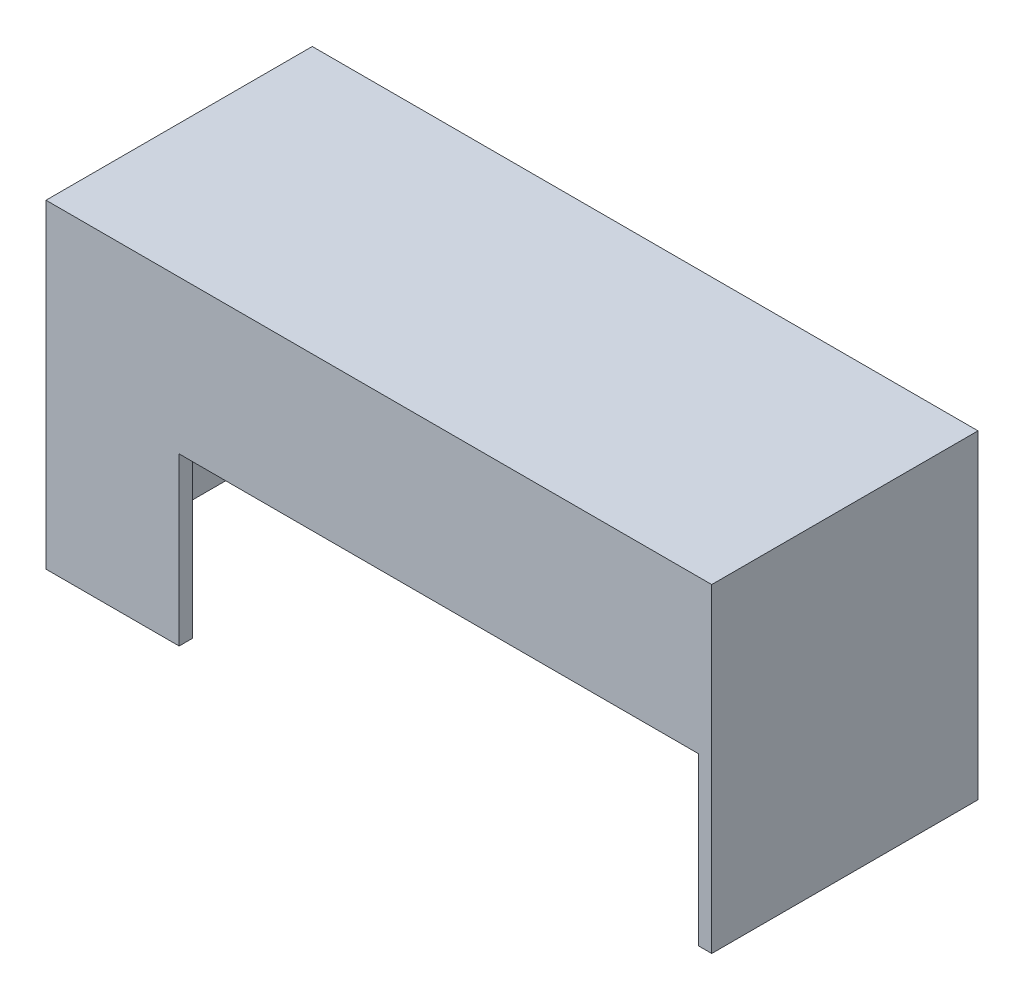
from build123d import *

# Parameters (mm, degrees)
SKETCH1_W           = 100
SKETCH1_H           = 50
BOSS_EXTRUDE1_DEPTH = 40
SHELL1_T            = -2
SKETCH2_W           = 100
SKETCH2_H           = 40
CUT_EXTRUDE1_DEPTH  = 40
SKETCH3_W           = 96
SKETCH3_H           = 21
BOSS_EXTRUDE2_DEPTH = 38
SKETCH4_W           = 20
SKETCH4_H           = 48
BOSS_EXTRUDE3_DEPTH = 2
SHELL2_START        = -45.319513939
SHELL2_OUTLINE_W    = 21
SHELL2_OUTLINE_H    = 36
SHELL2_DEPTH        = 96


# Read off the part's stored shape, not the designer's step: Shell2
with BuildPart() as part:
    # Sketch1 → Boss-Extrude1 (new body)
    with BuildSketch(Plane.XY):
        with Locations((2.680486061, 0.839885633)):
            Rectangle(SKETCH1_W, SKETCH1_H)
    extrude(amount=BOSS_EXTRUDE1_DEPTH)

    # Shell1
    shell1_openings = [part.faces().sort_by_distance(p)[0] for p in [
        (2.680486061, 0.839885633, 40),
    ]]
    offset(amount=SHELL1_T, openings=shell1_openings, kind=Kind.INTERSECTION)

    # Sketch2 → Cut-Extrude1 (cut)
    with BuildSketch(Plane(origin=(0, -22.160114367, 0), x_dir=(1, 0, 0), z_dir=(0, 1, 0))):
        with Locations((2.680486061, -20)):
            Rectangle(SKETCH2_W, SKETCH2_H)
    extrude(amount=-CUT_EXTRUDE1_DEPTH, mode=Mode.SUBTRACT)

    # Sketch3 → Boss-Extrude2 (add)
    with BuildSketch(Plane.XY.offset(2)):
        with Locations((2.680486061, 13.339885633)):
            Rectangle(SKETCH3_W, SKETCH3_H)
    extrude(amount=BOSS_EXTRUDE2_DEPTH)

    # Sketch4 → Boss-Extrude3 (add)
    with BuildSketch(Plane.XY.offset(40)):
        with Locations((-37.319513939, 1.839885633)):
            Rectangle(SKETCH4_W, SKETCH4_H)
    extrude(amount=-BOSS_EXTRUDE3_DEPTH)

    # Shell2 outline → Shell2 (cut)
    with BuildSketch(Plane.YZ.offset(SHELL2_START)):
        with Locations((13.339885633, 20)):
            Rectangle(SHELL2_OUTLINE_W, SHELL2_OUTLINE_H)
    extrude(amount=SHELL2_DEPTH, mode=Mode.SUBTRACT)


solid = part.part
